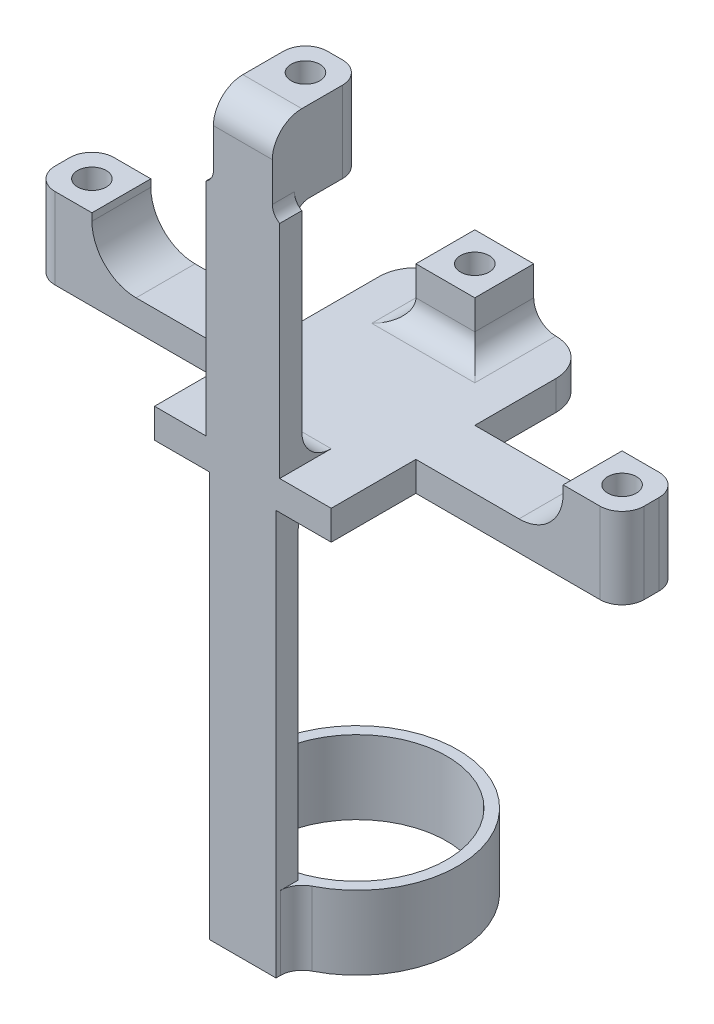
from build123d import *

# Parameters (mm, degrees)
SKETCH_1_R             = 13.7
SKETCH_1_R_2           = 12.2
EXTRUDE_1_DEPTH        = 10
SKETCH_3_W             = 9
SKETCH_3_H             = 55
EXTRUDE_2_DEPTH        = 3
SKETCH_4_W             = 24
SKETCH_4_H             = 35.5
EXTRUDE_3_DEPTH        = 4
FILLET_1_R             = 4
SKETCH_5_W             = 40
SKETCH_5_H             = 8
EXTRUDE_4_DEPTH        = 4
SKETCH_6_W             = 8
SKETCH_6_H             = 8
EXTRUDE_5_DEPTH        = 11
FILLET_2_R             = 6
HOLE_WIZARD_0_1_D      = 3.900000074
FILLET_2_OF_MIRROR_1_R = 6
SKETCH_11_W            = 8
SKETCH_11_H            = 8
EXTRUDE_6_DEPTH        = 11
HOLE_WIZARD_0_2_D      = 3.8999922
FILLET_3_R             = 3
FILLET_4_R             = 3
FILLET_5_R             = 3
SKETCH_14_W            = 10
SKETCH_14_H            = 3
EXTRUDE_7_DEPTH        = 30
FILLET_6_R             = 4
SKETCH_16_W            = 8
SKETCH_16_H            = 12.5
EXTRUDE_8_DEPTH        = 11
FILLET_7_R             = 4
FILLET_8_R             = 2
FILLET_9_R             = 2
FILLET_10_R            = 2
HOLE_WIZARD_0_3_D      = 3.900000074
HOLE_WIZARD_0_3_DEPTH  = 11
FILLET_11_R            = 5
FILLET_12_R            = 5
FILLET_13_R            = 3
FILLET_14_R            = 3
FILLET_15_R            = 3
FILLET_16_R            = 3
FILLET_17_R            = 3
FILLET_18_R            = 3
FILLET_19_R            = 3
FILLET_20_R            = 3


with BuildPart() as part:
    # ｽｹｯﾁ1 → ﾎﾞｽ - 押し出し1 (new body)
    with BuildSketch(Plane(origin=(0, 0, 0), x_dir=(1, 0, 0), z_dir=(0, 1, 0))):
        with Locations(Location((0, 0, 0), (0, 0, 270))):
            Circle(SKETCH_1_R)
        with Locations(Location((0, 0, 0), (0, 0, 270))):
            Circle(SKETCH_1_R_2, mode=Mode.SUBTRACT)
    extrude(amount=EXTRUDE_1_DEPTH)

    # ｽｹｯﾁ3 → ﾎﾞｽ - 押し出し2 (add)
    with BuildSketch(Plane.XY.offset(12.5)):
        with Locations((0, 27.5)):
            Rectangle(SKETCH_3_W, SKETCH_3_H)
    extrude(amount=EXTRUDE_2_DEPTH)

    # ｽｹｯﾁ4 → ﾎﾞｽ - 押し出し3 (add)
    with BuildSketch(Plane(origin=(0, 55, 0), x_dir=(1, 0, 0), z_dir=(0, 1, 0))):
        with Locations((0, 2.25)):
            Rectangle(SKETCH_4_W, SKETCH_4_H)
    extrude(amount=EXTRUDE_3_DEPTH)

    # ﾌｨﾚｯﾄ1
    fillet_1_edges = [part.edges().sort_by_distance(p)[0] for p in [
        (0, 55, 12.5),
    ]]
    fillet(fillet_1_edges, radius=FILLET_1_R)

    # ｽｹｯﾁ5 → ﾎﾞｽ - 押し出し4 (add)
    with BuildSketch(Plane(origin=(0, 55, 0), x_dir=(1, 0, 0), z_dir=(0, 1, 0))):
        with Locations((-20, 0)):
            Rectangle(SKETCH_5_W, SKETCH_5_H)
    extrude_4 = extrude(amount=EXTRUDE_4_DEPTH)

    # ｽｹｯﾁ6 → ﾎﾞｽ - 押し出し5 (add)
    with BuildSketch(Plane(origin=(0, 55, 0), x_dir=(1, 0, 0), z_dir=(0, 1, 0))):
        with Locations((-36, 0)):
            Rectangle(SKETCH_6_W, SKETCH_6_H)
    extrude_5 = extrude(amount=EXTRUDE_5_DEPTH)

    # ﾌｨﾚｯﾄ2
    fillet_2_edges = [part.edges().sort_by_distance(p)[0] for p in [
        (-32, 59, 0),
    ]]
    fillet(fillet_2_edges, radius=FILLET_2_R)

    # #0 すきま穴1 (through all)
    with Locations(Plane(origin=(0, 66, 0), x_dir=(1, 0, 0), z_dir=(0, 1, 0))):
        with Locations((-36, 0)):
            hole_wizard_0_1 = Hole(HOLE_WIZARD_0_1_D / 2)

    # ﾐﾗｰ1: ﾎﾞｽ - 押し出し4, ﾎﾞｽ - 押し出し5, #0 すきま穴1 across plane
    add(extrude_4.mirror(Plane(origin=(0, 0, 0), x_dir=(0, 0, 1), z_dir=(1, 0, 0))))
    add(extrude_5.mirror(Plane(origin=(0, 0, 0), x_dir=(0, 0, 1), z_dir=(1, 0, 0))))
    add(hole_wizard_0_1.mirror(Plane(origin=(0, 0, 0), x_dir=(0, 0, 1), z_dir=(1, 0, 0))), mode=Mode.SUBTRACT)

    # ﾌｨﾚｯﾄ2 of ﾐﾗｰ1
    fillet_2_of_mirror_1_edges = [part.edges().sort_by_distance(p)[0] for p in [
        (32, 59, 0),
    ]]
    fillet(fillet_2_of_mirror_1_edges, radius=FILLET_2_OF_MIRROR_1_R)

    # ｽｹｯﾁ11 → ﾎﾞｽ - 押し出し6 (add)
    with BuildSketch(Plane(origin=(0, 55, 0), x_dir=(1, 0, 0), z_dir=(0, 1, 0))):
        with Locations((0, 16)):
            Rectangle(SKETCH_11_W, SKETCH_11_H)
    extrude(amount=EXTRUDE_6_DEPTH)

    # #0 すきま穴2 (through all)
    with Locations(Plane(origin=(0, 66, 0), x_dir=(1, 0, 0), z_dir=(0, 1, 0))):
        with Locations((0, 16)):
            Hole(HOLE_WIZARD_0_2_D / 2)

    # ﾌｨﾚｯﾄ3
    fillet_3_edges = [part.edges().sort_by_distance(p)[0] for p in [
        (0, 59, -12),
    ]]
    fillet(fillet_3_edges, radius=FILLET_3_R)

    # ﾌｨﾚｯﾄ4
    fillet_4_edges = [part.edges().sort_by_distance(p)[0] for p in [
        (-4, 59, -14.5),
    ]]
    fillet(fillet_4_edges, radius=FILLET_4_R)

    # ﾌｨﾚｯﾄ5
    fillet_5_edges = [part.edges().sort_by_distance(p)[0] for p in [
        (4, 59, -14.5),
    ]]
    fillet(fillet_5_edges, radius=FILLET_5_R)

    # ｽｹｯﾁ14 → ﾎﾞｽ - 押し出し7 (add)
    with BuildSketch(Plane(origin=(0, 59, 0), x_dir=(1, 0, 0), z_dir=(0, 1, 0))):
        with Locations((0, -14)):
            Rectangle(SKETCH_14_W, SKETCH_14_H)
    extrude(amount=EXTRUDE_7_DEPTH)

    # ﾌｨﾚｯﾄ6
    fillet_6_edges = [part.edges().sort_by_distance(p)[0] for p in [
        (0, 59, 12.5),
    ]]
    fillet(fillet_6_edges, radius=FILLET_6_R)

    # ｽｹｯﾁ16 → ﾎﾞｽ - 押し出し8 (add)
    with BuildSketch(Plane(origin=(0, 89, 0), x_dir=(1, 0, 0), z_dir=(0, 1, 0))):
        with Locations((0, -9.25)):
            Rectangle(SKETCH_16_W, SKETCH_16_H)
    extrude(amount=EXTRUDE_8_DEPTH)

    # ﾌｨﾚｯﾄ7
    fillet_7_edges = [part.edges().sort_by_distance(p)[0] for p in [
        (0, 100, 15.5),
    ]]
    fillet(fillet_7_edges, radius=FILLET_7_R)

    # ﾌｨﾚｯﾄ8
    fillet_8_edges = [part.edges().sort_by_distance(p)[0] for p in [
        (0, 89, 12.5),
    ]]
    fillet(fillet_8_edges, radius=FILLET_8_R)

    # ﾌｨﾚｯﾄ9
    # the kernel refuses this fillet: 2 mm, written as the material it adds along each edge
    with BuildSketch(Plane(origin=(4, 89, 15.5), x_dir=(0, 1, 0), z_dir=(0, 0, -1))) as fillet_9_piece_1:
        with BuildLine():
            CenterArc((1.732050808, 2), FILLET_9_R, 210, 60)
            Line((0, 1), (0, 0))
            Line((0, 0), (1.732050808, 0))
        make_face()
    extrude(amount=3)

    # ﾌｨﾚｯﾄ10
    # the kernel refuses this fillet: 2 mm, written as the material it adds along each edge
    with BuildSketch(Plane(origin=(-4, 89, 12.5), x_dir=(-1, 0, 0), z_dir=(0, 0, 1))) as fillet_10_piece_1:
        with BuildLine():
            CenterArc((2, -1.732050808), FILLET_10_R, 120, 60)
            Line((0, -1.732050808), (0, 0))
            Line((0, 0), (1, 0))
        make_face()
    extrude(amount=3)

    # #0 すきま穴3
    with Locations(Plane(origin=(0, 100, 0), x_dir=(1, 0, 0), z_dir=(0, 1, 0))):
        with Locations((0, -7)):
            Hole(HOLE_WIZARD_0_3_D / 2, depth=HOLE_WIZARD_0_3_DEPTH)

    # ﾌｨﾚｯﾄ11
    fillet_11_edges = [part.edges().sort_by_distance(p)[0] for p in [
        (12, 57, -20),
    ]]
    fillet(fillet_11_edges, radius=FILLET_11_R)

    # ﾌｨﾚｯﾄ12
    fillet_12_edges = [part.edges().sort_by_distance(p)[0] for p in [
        (-12, 57, -20),
    ]]
    fillet(fillet_12_edges, radius=FILLET_12_R)

    # ﾌｨﾚｯﾄ13
    fillet_13_edges = [part.edges().sort_by_distance(p)[0] for p in [
        (-40, 60.5, -4),
    ]]
    fillet(fillet_13_edges, radius=FILLET_13_R)

    # ﾌｨﾚｯﾄ14
    fillet_14_edges = [part.edges().sort_by_distance(p)[0] for p in [
        (-40, 60.5, 4),
    ]]
    fillet(fillet_14_edges, radius=FILLET_14_R)

    # ﾌｨﾚｯﾄ15
    fillet_15_edges = [part.edges().sort_by_distance(p)[0] for p in [
        (40, 60.5, -4),
    ]]
    fillet(fillet_15_edges, radius=FILLET_15_R)

    # ﾌｨﾚｯﾄ16
    fillet_16_edges = [part.edges().sort_by_distance(p)[0] for p in [
        (40, 60.5, 4),
    ]]
    fillet(fillet_16_edges, radius=FILLET_16_R)

    # ﾌｨﾚｯﾄ17
    fillet_17_edges = [part.edges().sort_by_distance(p)[0] for p in [
        (4, 94.5, 3),
    ]]
    fillet(fillet_17_edges, radius=FILLET_17_R)

    # ﾌｨﾚｯﾄ18
    fillet_18_edges = [part.edges().sort_by_distance(p)[0] for p in [
        (-4, 94.5, 3),
    ]]
    fillet(fillet_18_edges, radius=FILLET_18_R)

    # ﾌｨﾚｯﾄ19
    fillet_19_edges = [part.edges().sort_by_distance(p)[0] for p in [
        (4.5, 5, 12.939860896),
    ]]
    fillet(fillet_19_edges, radius=FILLET_19_R)

    # ﾌｨﾚｯﾄ20
    fillet_20_edges = [part.edges().sort_by_distance(p)[0] for p in [
        (-4.5, 5, 12.939860896),
    ]]
    fillet(fillet_20_edges, radius=FILLET_20_R)


solid = part.part
